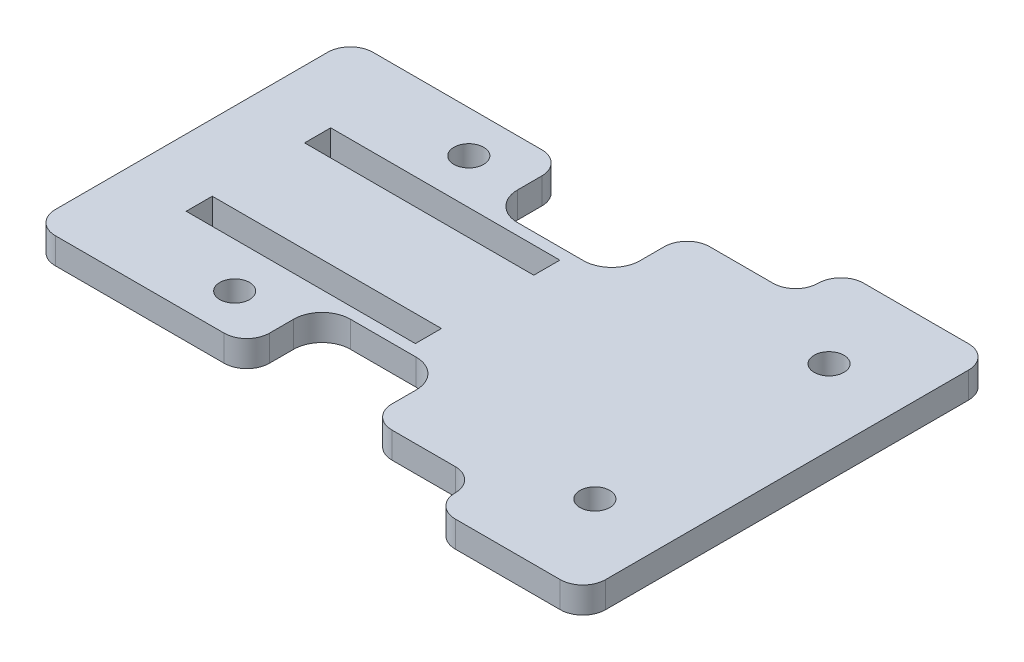
from build123d import *

# Parameters (mm, degrees)
EXTRUDE_1_DEPTH     = 4.6
SKETCH_1_R          = 2.625
SKETCH_1_W          = 40.4
SKETCH_1_H          = 4.6
CUT_EXTRUDE_1_DEPTH = 4.6
FILLET_1_R          = 5
FILLET_2_R          = 4


with BuildPart() as part:
    # 草图3 → 凸台-拉伸1 (new body)
    with BuildSketch(Plane(origin=(0, 0, 0), x_dir=(1, 0, 0), z_dir=(0, 1, 0))):
        Polygon((-40, 28), (-60, 28), (-60, -28), (-40, -28), (18.5, -28), (18.5, -36), (45, -36), (45, -28), (45, 28), (45, 36), (18.5, 36), (18.5, 28), align=None)
    extrude(amount=EXTRUDE_1_DEPTH)

    # 草图1 → 切除-拉伸1 (cut)
    with BuildSketch(Plane(origin=(0, 0, 0), x_dir=(1, 0, 0), z_dir=(0, 1, 0))):
        with Locations(Location((-31.75, 20.6375, 0), (0, 0, 270))):
            Circle(SKETCH_1_R)
        with Locations(Location((31.75, 20.6375, 0), (0, 0, 90))):
            Circle(SKETCH_1_R)
        with Locations(Location((31.75, -20.6375, 0), (0, 0, 270))):
            Circle(SKETCH_1_R)
        with Locations(Location((-31.75, -20.6375, 0), (0, 0, 90))):
            Circle(SKETCH_1_R)
        with Locations((-28, -10.4375)):
            Rectangle(SKETCH_1_W, SKETCH_1_H)
        with Locations((-28, 10.4375)):
            Rectangle(SKETCH_1_W, SKETCH_1_H)
        Polygon((-22.25, -26.5375), (-22.25, -14.7375), (-0.65, -14.7375), (-0.65, -26.5375), (-0.65, -30.009482824), (-22.25, -30.009482824), align=None)
        Polygon((-22.25, 14.7375), (-0.65, 14.7375), (-0.65, 26.5375), (-0.65, 30.009482824), (-22.25, 30.009482824), (-22.25, 26.5375), align=None)
    extrude(amount=CUT_EXTRUDE_1_DEPTH, mode=Mode.SUBTRACT)

    # 圆角1
    fillet_1_edges = [part.edges().sort_by_distance(p)[0] for p in [
        (-22.25, 2.3, 14.7375),
        (-0.65, 2.3, 14.7375),
        (-0.65, 2.3, -14.7375),
        (-22.25, 2.3, -14.7375),
    ]]
    fillet(fillet_1_edges, radius=FILLET_1_R)

    # 圆角2
    fillet_2_edges = [part.edges().sort_by_distance(p)[0] for p in [
        (-0.65, 2.3, 28),
        (-22.25, 2.3, 28),
        (-0.65, 2.3, -28),
        (-22.25, 2.3, -28),
        (-60, 2.3, 28),
        (-60, 2.3, -28),
        (18.5, 2.3, -28),
        (18.5, 2.3, -36),
        (45, 2.3, -36),
        (45, 2.3, 36),
        (18.5, 2.3, 36),
        (18.5, 2.3, 28),
    ]]
    fillet(fillet_2_edges, radius=FILLET_2_R - 0.0001)  # a hair under: the kernel refuses the full size


solid = part.part
